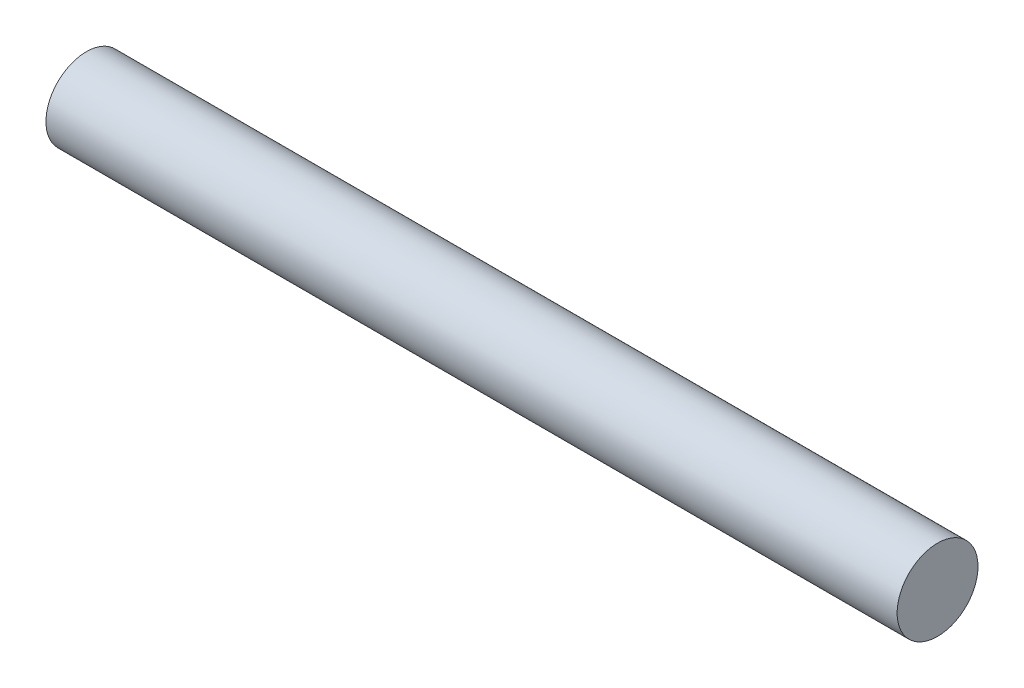
from build123d import *

# Parameters (mm, degrees)
CROQUIS1_R              = 9.5
SALIENTE_EXTRUIR1_DEPTH = 200


with BuildPart() as part:
    # Croquis1 → Saliente-Extruir1 (new body)
    with BuildSketch(Plane(origin=(0, 0, 0), x_dir=(0, 0, -1), z_dir=(1, 0, 0))):
        Circle(CROQUIS1_R)
    extrude(amount=SALIENTE_EXTRUIR1_DEPTH)


solid = part.part
